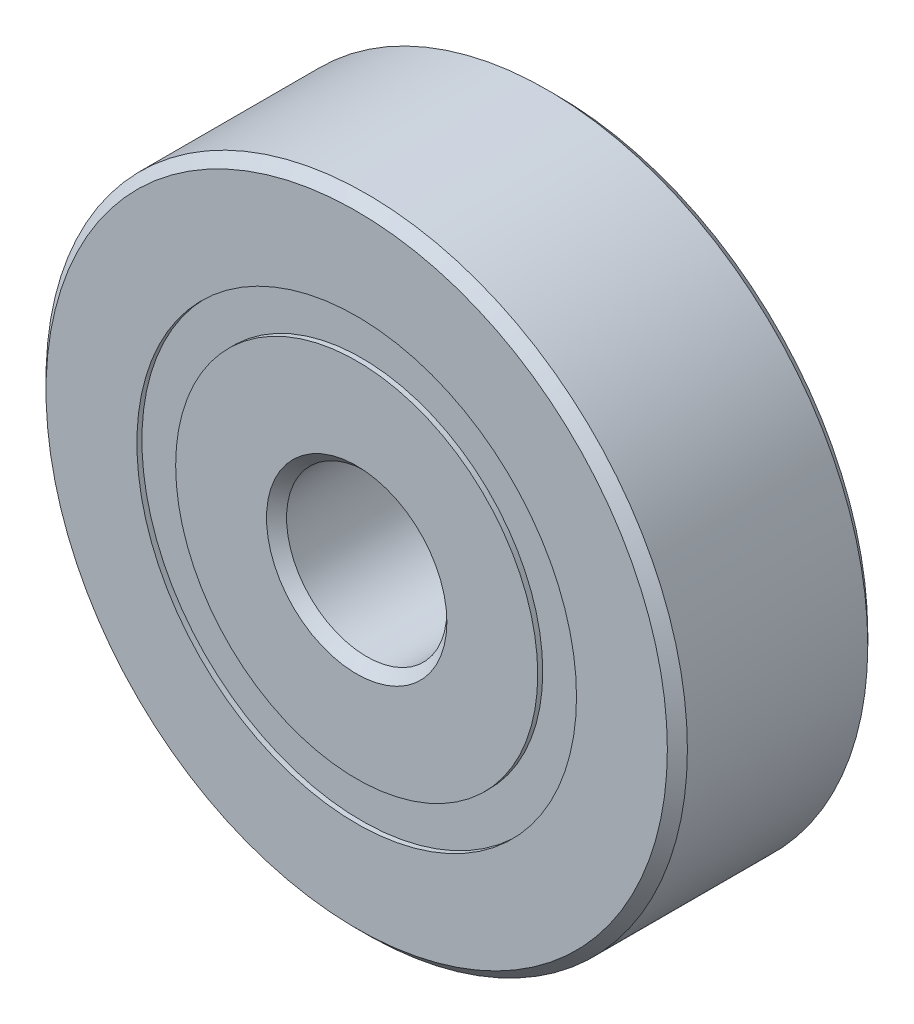
from build123d import *

# Parameters (mm, degrees)
CIRPATTERN1_COUNT = 12
SKETCH5_W         = 1.163242561
SKETCH5_H         = 0.967032968


with BuildPart() as part:
    # Sketch1 → Revolve1 (revolve)
    with BuildSketch(Plane(origin=(0, 0, 0), x_dir=(0, 0, -1), z_dir=(1, 0, 0))):
        with BuildLine():
            Line((2.25, 8), (-2.25, 8))
            Line((-2.25, 8), (-2.5, 7.75))
            Line((-2.5, 7.75), (-2.5, 5.483516484))
            Line((-2.5, 5.483516484), (-1.111111111, 5.483516484))
            ThreePointArc((-1.111111111, 5.483516484), (0, 6.211757439), (1.111111111, 5.483516484))
            Line((1.111111111, 5.483516484), (2.5, 5.483516484))
            Line((2.5, 5.483516484), (2.5, 7.75))
            Line((2.5, 7.75), (2.25, 8))
        make_face()
    revolve(axis=Axis((0, 0, 2.5), (0, 0, -1)))


with BuildPart() as body_2:
    # Sketch3 → Revolve3 (revolve)
    with BuildSketch(Plane(origin=(0, 0, 0), x_dir=(0, 0, -1), z_dir=(1, 0, 0))):
        with BuildLine():
            Line((-2.5, 4.516483516), (-1.111111111, 4.516483516))
            ThreePointArc((-1.111111111, 4.516483516), (0, 3.788242561), (1.111111111, 4.516483516))
            Line((1.111111111, 4.516483516), (2.5, 4.516483516))
            Line((2.5, 4.516483516), (2.5, 2.25))
            Line((2.5, 2.25), (2.25, 2))
            Line((2.25, 2), (-2.25, 2))
            Line((-2.25, 2), (-2.5, 2.25))
            Line((-2.5, 2.25), (-2.5, 4.516483516))
        make_face()
    revolve(axis=Axis((0, 0, 2.5), (0, 0, -1)))


with BuildPart() as body_3:
    # Sketch4 → Revolve4 (revolve)
    with BuildSketch(Plane(origin=(0, 0, 0), x_dir=(0, 0, -1), z_dir=(1, 0, 0))):
        with BuildLine():
            Line((-1.211757439, 5), (1.211757439, 5))
            ThreePointArc((1.211757439, 5), (0, 6.211757439), (-1.211757439, 5))
        make_face()
    revolve(axis=Axis((0, 5, 1.211757439), (0, 0, -1)))


with BuildPart() as cirpattern1_1:
    # CirPattern1: pattern copy
    add(body_3.part.rotate(Axis((0, 0, -2.5), (0, 0, 1)), 1 * 360 / CIRPATTERN1_COUNT))


with BuildPart() as cirpattern1_2:
    # CirPattern1: pattern copy
    add(body_3.part.rotate(Axis((0, 0, -2.5), (0, 0, 1)), 2 * 360 / CIRPATTERN1_COUNT))


with BuildPart() as cirpattern1_3:
    # CirPattern1: pattern copy
    add(body_3.part.rotate(Axis((0, 0, -2.5), (0, 0, 1)), 3 * 360 / CIRPATTERN1_COUNT))


with BuildPart() as cirpattern1_4:
    # CirPattern1: pattern copy
    add(body_3.part.rotate(Axis((0, 0, -2.5), (0, 0, 1)), 4 * 360 / CIRPATTERN1_COUNT))


with BuildPart() as cirpattern1_5:
    # CirPattern1: pattern copy
    add(body_3.part.rotate(Axis((0, 0, -2.5), (0, 0, 1)), 5 * 360 / CIRPATTERN1_COUNT))


with BuildPart() as cirpattern1_6:
    # CirPattern1: pattern copy
    add(body_3.part.rotate(Axis((0, 0, -2.5), (0, 0, 1)), 6 * 360 / CIRPATTERN1_COUNT))


with BuildPart() as cirpattern1_7:
    # CirPattern1: pattern copy
    add(body_3.part.rotate(Axis((0, 0, -2.5), (0, 0, 1)), 7 * 360 / CIRPATTERN1_COUNT))


with BuildPart() as cirpattern1_8:
    # CirPattern1: pattern copy
    add(body_3.part.rotate(Axis((0, 0, -2.5), (0, 0, 1)), 8 * 360 / CIRPATTERN1_COUNT))


with BuildPart() as cirpattern1_9:
    # CirPattern1: pattern copy
    add(body_3.part.rotate(Axis((0, 0, -2.5), (0, 0, 1)), 9 * 360 / CIRPATTERN1_COUNT))


with BuildPart() as cirpattern1_10:
    # CirPattern1: pattern copy
    add(body_3.part.rotate(Axis((0, 0, -2.5), (0, 0, 1)), 10 * 360 / CIRPATTERN1_COUNT))


with BuildPart() as cirpattern1_11:
    # CirPattern1: pattern copy
    add(body_3.part.rotate(Axis((0, 0, -2.5), (0, 0, 1)), 11 * 360 / CIRPATTERN1_COUNT))


with BuildPart() as body_15:
    # Sketch5 → Revolve5 (revolve)
    with BuildSketch(Plane(origin=(0, 0, 0), x_dir=(0, 0, -1), z_dir=(1, 0, 0))):
        with Locations((-1.79337872, 5)):
            Rectangle(SKETCH5_W, SKETCH5_H)
        with Locations((1.79337872, 5)):
            Rectangle(SKETCH5_W, SKETCH5_H)
    revolve(axis=Axis((0, 0, 2.5), (0, 0, -1)))


solid = Compound([part.part, body_2.part, body_3.part, cirpattern1_1.part, cirpattern1_2.part, cirpattern1_3.part, cirpattern1_4.part, cirpattern1_5.part, cirpattern1_6.part, cirpattern1_7.part, cirpattern1_8.part, cirpattern1_9.part, cirpattern1_10.part, cirpattern1_11.part, body_15.part])
